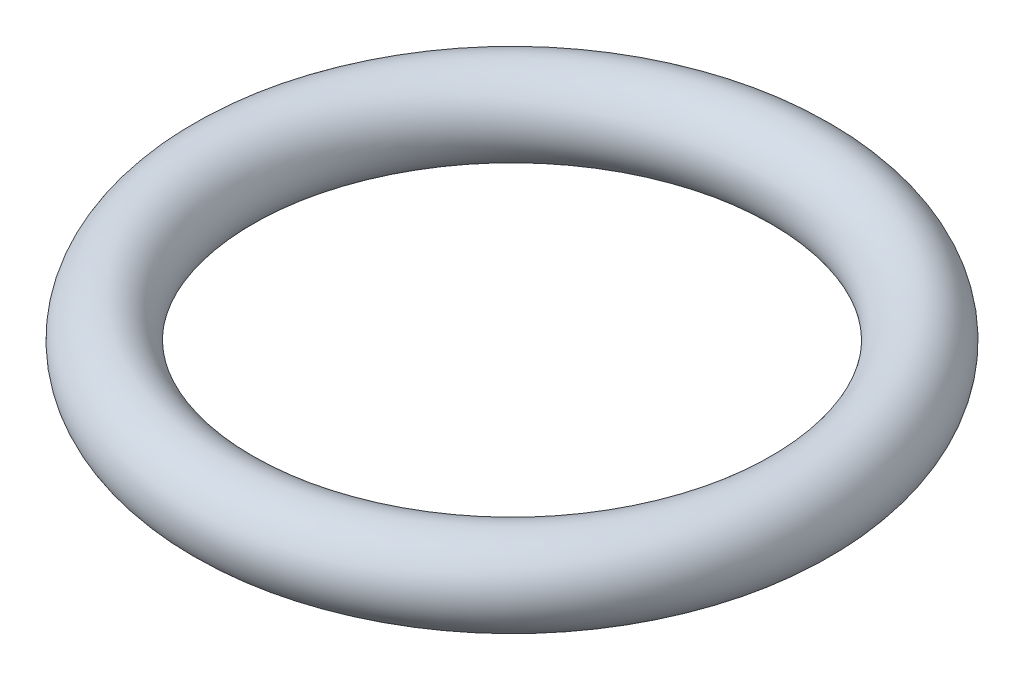
from build123d import *

# Parameters (mm, degrees)
SKETCH2_R = 0.75


with BuildPart() as part:
    # Sketch2 → Revolve1 (revolve)
    with BuildSketch(Plane.XY):
        with Locations((5.25, 0)):
            Circle(SKETCH2_R)
    revolve(axis=Axis((0, 0, 0), (0, 1, 0)))


solid = part.part
